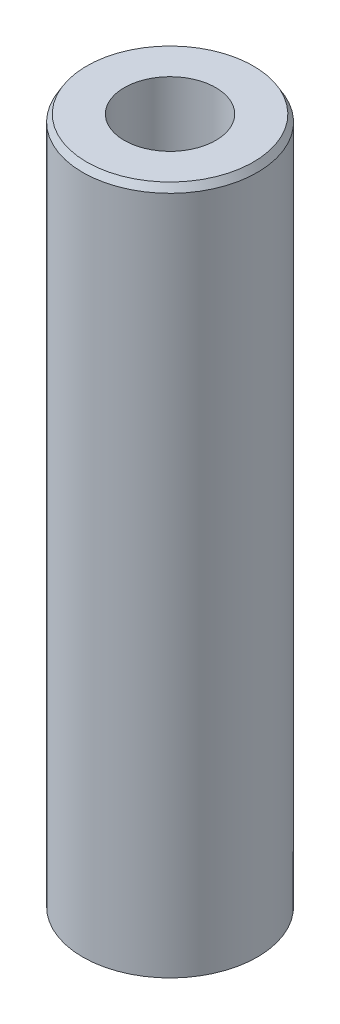
from build123d import *
from OCP.BRepFilletAPI import BRepFilletAPI_MakeChamfer

# Parameters (mm, degrees)
SKETCH1_R           = 32.5
BOSS_EXTRUDE1_DEPTH = 256.982664736
SKETCH2_R           = 17.031568218
CUT_EXTRUDE1_DEPTH  = 262.060510178
CHAMFER1_SIZE       = 2.589900144
CHAMFER1_SIZE2      = 1.495279545


with BuildPart() as part:
    # Sketch1 → Boss-Extrude1 (new body)
    with BuildSketch(Plane(origin=(0, 0, 0), x_dir=(1, 0, 0), z_dir=(0, 1, 0))):
        Circle(SKETCH1_R)
    extrude(amount=BOSS_EXTRUDE1_DEPTH)

    # Sketch2 → Cut-Extrude1 (cut, through all)
    with BuildSketch(Plane(origin=(0, 0, 0), x_dir=(1, 0, 0), z_dir=(0, 1, 0))):
        Circle(SKETCH2_R)
    extrude(amount=CUT_EXTRUDE1_DEPTH, mode=Mode.SUBTRACT)

    # Chamfer1: one chamfer whose edges measure the first distance from different faces: ONE call of the kernel's chamfer builder (chamfer() names one face for all edges)
    chamfer1_edges_1 = [part.edges().sort_by_distance(p)[0] for p in [
        (-32.5, 256.982664736, 0),
    ]]
    chamfer1_side_1 = [part.faces().sort_by_distance(p)[0] for p in [
        (-32.5, 128.491332368, 0),
    ]]
    chamfer1_edges_2 = [part.edges().sort_by_distance(p)[0] for p in [
        (-32.5, 0, 0),
    ]]
    chamfer1_side_2 = [part.faces().sort_by_distance(p)[0] for p in [
        (-31.580761184, 0, 0),
    ]]
    chamfer1 = BRepFilletAPI_MakeChamfer(part.part.solid().wrapped)
    for e in chamfer1_edges_1:
        chamfer1.Add(CHAMFER1_SIZE, CHAMFER1_SIZE2, e.wrapped, chamfer1_side_1[0].wrapped)  # the first distance lies on this face
    for e in chamfer1_edges_2:
        chamfer1.Add(CHAMFER1_SIZE, CHAMFER1_SIZE2, e.wrapped, chamfer1_side_2[0].wrapped)  # the first distance lies on this face
    add(Compound.cast(chamfer1.Shape()), mode=Mode.REPLACE)


solid = part.part
